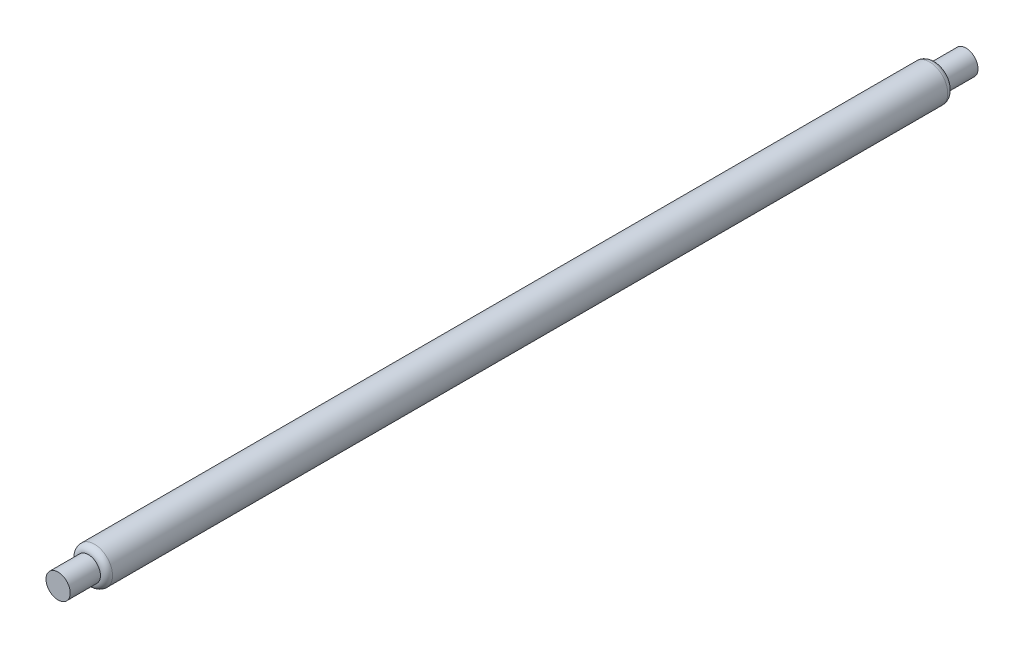
from build123d import *

# Parameters (mm, degrees)
SKETCH1_R            = 6
BOSS_EXTRUDE1_DEPTH  = 150
SKETCH2_R            = 6
SKETCH2_R_2          = 4
CUT_EXTRUDE1_DEPTH   = 10
FILLET1_R            = 2
FILLET1_OF_MIRROR1_R = 2


with BuildPart() as part:
    # Sketch1 → Boss-Extrude1 (new, symmetric)
    with BuildSketch(Plane.XY):
        Circle(SKETCH1_R)
    extrude(amount=BOSS_EXTRUDE1_DEPTH, both=True)

    # Sketch2 → Cut-Extrude1 (cut)
    with BuildSketch(Plane.XY.offset(150)):
        Circle(SKETCH2_R)
        Circle(SKETCH2_R_2, mode=Mode.SUBTRACT)
    cut_extrude1 = extrude(amount=-CUT_EXTRUDE1_DEPTH, mode=Mode.SUBTRACT)

    # Fillet1
    fillet1_edges = [part.edges().sort_by_distance(p)[0] for p in [
        (-6, 0, 140),
    ]]
    fillet(fillet1_edges, radius=FILLET1_R - 0.0001)  # a hair under: the kernel refuses the full size

    # Mirror1: Cut-Extrude1 across plane
    add(cut_extrude1.mirror(Plane.XY), mode=Mode.SUBTRACT)

    # Fillet1 of Mirror1
    fillet1_of_mirror1_edges = [part.edges().sort_by_distance(p)[0] for p in [
        (-6, 0, -140),
    ]]
    fillet(fillet1_of_mirror1_edges, radius=FILLET1_OF_MIRROR1_R - 0.0001)  # a hair under: the kernel refuses the full size


solid = part.part
